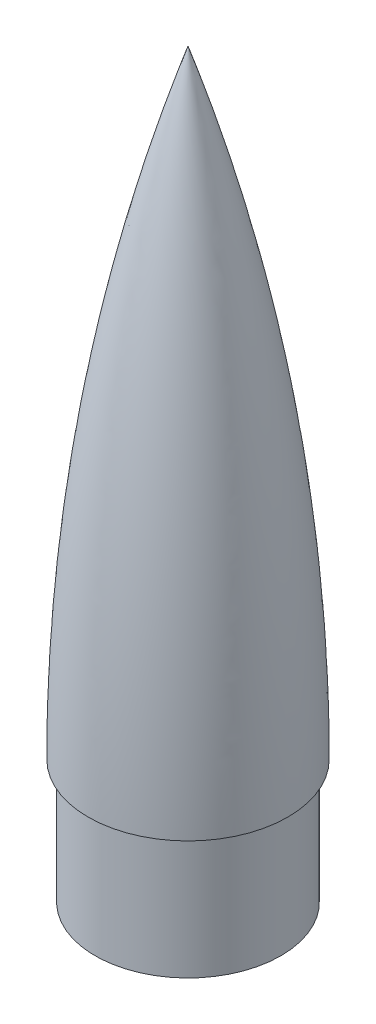
from build123d import *


with BuildPart() as part:
    # Sketch3 → Revolve3 (revolve)
    with BuildSketch(Plane.XY):
        with BuildLine():
            ThreePointArc((20.5232, 25.4), (15.359333225, 89.723793689), (0, 152.4))
            Line((0, 152.4), (0, 0))
            Line((0, 0), (19.1008, 0))
            Line((19.1008, 0), (19.1008, 25.4))
            Line((19.1008, 25.4), (20.5232, 25.4))
        make_face()
    revolve(axis=Axis((0, 152.4, 0), (0, -1, 0)))


solid = part.part
